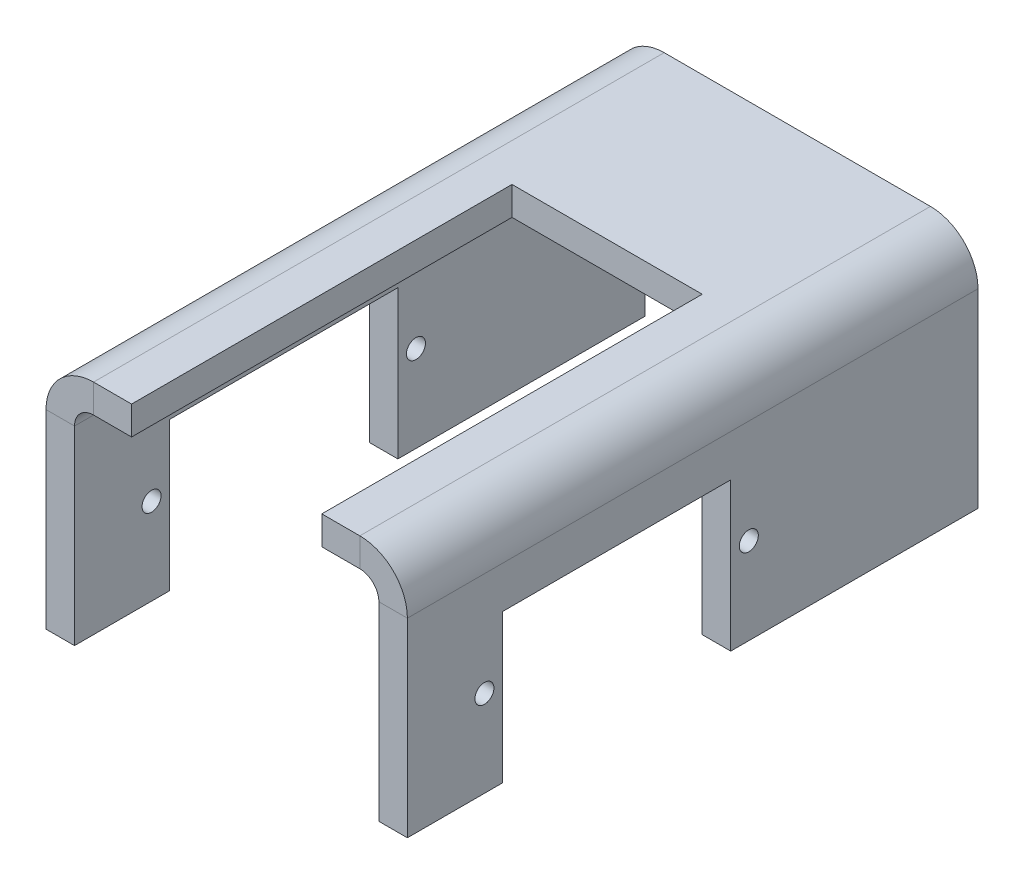
from build123d import *

# Parameters (mm, degrees)
SKETCH1_W                      = 32
SKETCH1_H                      = 60
BASE_FLANGE1_DEPTH             = 3
EDGE_FLANGE1_STRIP_W           = 16
EDGE_FLANGE1_STRIP_H           = 3
EDGE_FLANGE1_STRIP_CUT_DEPTH   = 60
EDGE_FLANGE1_STRIP_2_W         = 16
EDGE_FLANGE1_STRIP_2_H         = 3
EDGE_FLANGE1_STRIP_CUT_2_DEPTH = 60
EDGE_FLANGE1_DEPTH             = 60
EDGE_FLANGE1_BEND_DEPTH        = 60
SKETCH18_R                     = 1
SKETCH18_W                     = 24
SKETCH18_H                     = 13
CUT_EXTRUDE1_DEPTH             = 68.01070511
SKETCH19_W                     = 20
SKETCH19_H                     = 40
CUT_EXTRUDE2_DEPTH             = 60.604400839
SKETCH20_W                     = 24
SKETCH20_H                     = 2.600711811
CUT_EXTRUDE3_DEPTH             = 68.01070511


# Sheet-metal steps are written as plain solids
with BuildPart() as part:
    # Sketch1 → Base-Flange1 (new body)
    with BuildSketch(Plane(origin=(0, 0, 0), x_dir=(1, 0, 0), z_dir=(0, 1, 0))):
        with Locations((-3.5, -19.208074534)):
            Rectangle(SKETCH1_W, SKETCH1_H)
    extrude(amount=-BASE_FLANGE1_DEPTH)

    # Edge-Flange1 strip (across the edge) → Edge-Flange1 strip cut (cut)
    with BuildSketch(Plane(origin=(12.5, -3, -10.791925466), x_dir=(-1, 0, 0), z_dir=(0, 0, 1))):
        with Locations((-6, -1.5)):
            Rectangle(EDGE_FLANGE1_STRIP_W, EDGE_FLANGE1_STRIP_H)
    extrude(amount=EDGE_FLANGE1_STRIP_CUT_DEPTH, mode=Mode.SUBTRACT)

    # Edge-Flange1 strip 2 (across the edge) → Edge-Flange1 strip cut 2 (cut)
    with BuildSketch(Plane(origin=(-19.5, -3, 49.208074534), x_dir=(1, 0, 0), z_dir=(0, 0, -1))):
        with Locations((-6, -1.5)):
            Rectangle(EDGE_FLANGE1_STRIP_2_W, EDGE_FLANGE1_STRIP_2_H)
    extrude(amount=EDGE_FLANGE1_STRIP_CUT_2_DEPTH, mode=Mode.SUBTRACT)

    # Edge-Flange1 section (across the edge) → Edge-Flange1 (add)
    with BuildSketch(Plane(origin=(12.5, -3, -10.791925466), x_dir=(-1, 0, 0), z_dir=(0, 0, 1))):
        with BuildLine():
            Line((-3, 2), (-3, 22))
            Line((-3, 22), (0, 22))
            Line((0, 22), (0, 2))
            ThreePointArc((0, 2), (0.585786438, 0.585786438), (2, 0))
            Line((2, 0), (2, -3))
            ThreePointArc((2, -3), (-1.535533906, -1.535533906), (-3, 2))
        make_face()
    extrude(amount=EDGE_FLANGE1_DEPTH)

    # Edge-Flange1 section 2 (across the edge) → Edge-Flange1 bend (add)
    with BuildSketch(Plane(origin=(-19.5, -3, 49.208074534), x_dir=(1, 0, 0), z_dir=(0, 0, -1))):
        with BuildLine():
            Line((-3, 2), (-3, 22))
            Line((-3, 22), (0, 22))
            Line((0, 22), (0, 2))
            ThreePointArc((0, 2), (0.585786438, 0.585786438), (2, 0))
            Line((2, 0), (2, -3))
            ThreePointArc((2, -3), (-1.535533906, -1.535533906), (-3, 2))
        make_face()
    extrude(amount=EDGE_FLANGE1_BEND_DEPTH)

    # Sketch18 → Cut-Extrude1 (cut, through all)
    with BuildSketch(Plane(origin=(15.5, 0, 0), x_dir=(0, 0, -1), z_dir=(1, 0, 0))):
        with Locations(Location((-41.108074534, -15.899288189, 0), (0, 0, 90))):
            Circle(SKETCH18_R)
        with Locations(Location((-13.308074534, -15.899288189, 0), (0, 0, 90))):
            Circle(SKETCH18_R)
        with Locations((-27.208074534, -15.899288189)):
            Rectangle(SKETCH18_W, SKETCH18_H)
    extrude(amount=-CUT_EXTRUDE1_DEPTH, mode=Mode.SUBTRACT)

    # Sketch19 → Cut-Extrude2 (cut, through all)
    with BuildSketch(Plane(origin=(0, 0, 0), x_dir=(1, 0, 0), z_dir=(0, 1, 0))):
        with Locations((-3.5, -29.208074534)):
            Rectangle(SKETCH19_W, SKETCH19_H)
    extrude(amount=-CUT_EXTRUDE2_DEPTH, mode=Mode.SUBTRACT)

    # Sketch20 → Cut-Extrude3 (cut, through all)
    with BuildSketch(Plane(origin=(15.5, 0, 0), x_dir=(0, 0, -1), z_dir=(1, 0, 0))):
        with Locations((-27.208074534, -23.699644095)):
            Rectangle(SKETCH20_W, SKETCH20_H)
    extrude(amount=-CUT_EXTRUDE3_DEPTH, mode=Mode.SUBTRACT)


solid = part.part
